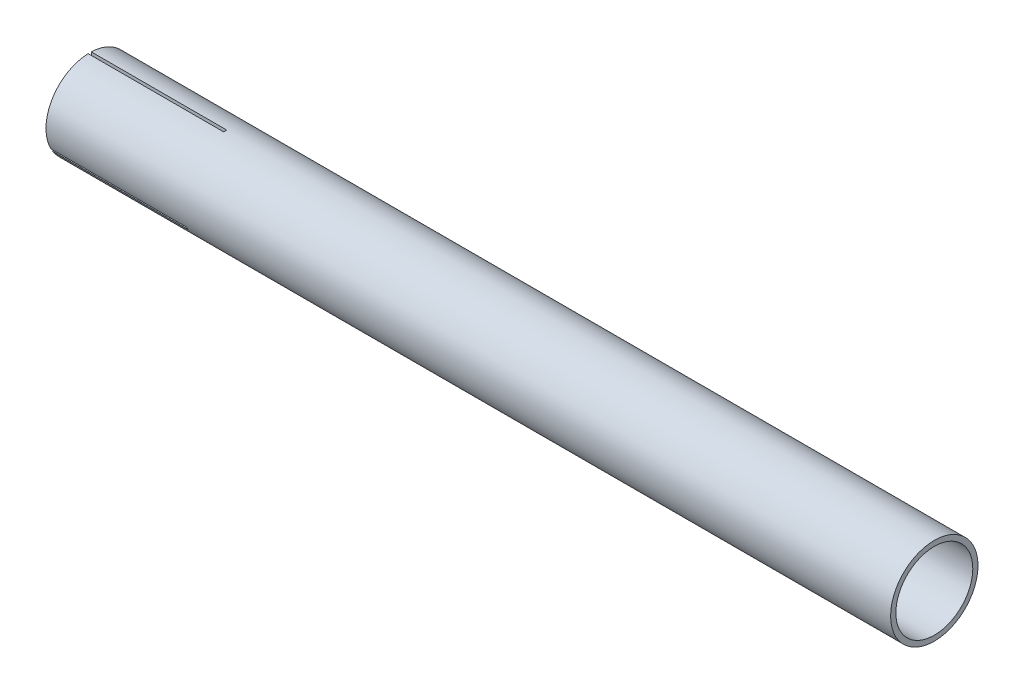
from build123d import *

# Parameters (mm, degrees)
SKETCH1_R               = 41.9
SKETCH1_R_2             = 36.9
BOSS_EXTRUDE1_DEPTH     = 810
CUT_EXTRUDE_THIN1_START = -130
CUT_EXTRUDE_THIN1_DEPTH = 130
SKETCH3_R               = 36.9
BOSS_EXTRUDE2_DEPTH     = 2


# Read off the part's stored shape, not the designer's step: Cut-Extrude-Thin1
with BuildPart() as part:
    # Sketch1 → Boss-Extrude1 (new body)
    with BuildSketch(Plane(origin=(0, 0, 0), x_dir=(0, 0, -1), z_dir=(1, 0, 0))):
        Circle(SKETCH1_R)
        Circle(SKETCH1_R_2, mode=Mode.SUBTRACT)
    extrude(amount=BOSS_EXTRUDE1_DEPTH)

    # Cut-Extrude-Thin1 outline → Cut-Extrude-Thin1 (cut)
    with BuildSketch(Plane.ZY.offset(CUT_EXTRUDE_THIN1_START)):
        with BuildLine():
            ThreePointArc((-31.179923269, -19.733787901), (-31.9563374, -18.45), (-32.67992327, -17.135711689))
            Line((-32.67992327, -17.135711689), (-37.013204492, -19.637532769))
            ThreePointArc((-37.013204492, -19.637532769), (-36.286464419, -20.95), (-35.513204492, -22.235608981))
            Line((-35.513204492, -22.235608981), (-31.179923269, -19.733787901))
        make_face()
        with BuildLine():
            Line((-1.5, 41.87314175), (-1.5, 36.86949959))
            ThreePointArc((-1.5, 36.86949959), (0, 36.9), (1.5, 36.86949959))
            Line((1.5, 36.86949959), (1.5, 41.87314175))
            ThreePointArc((1.5, 41.87314175), (0, 41.9), (-1.5, 41.87314175))
        make_face()
        with BuildLine():
            ThreePointArc((32.67992327, -17.135711689), (31.9563374, -18.45), (31.179923269, -19.733787901))
            Line((31.179923269, -19.733787901), (35.513204492, -22.235608981))
            ThreePointArc((35.513204492, -22.235608981), (36.286464419, -20.95), (37.013204492, -19.637532769))
            Line((37.013204492, -19.637532769), (32.67992327, -17.135711689))
        make_face()
    extrude(amount=CUT_EXTRUDE_THIN1_DEPTH, mode=Mode.SUBTRACT)

    # Sketch3 → Boss-Extrude2 (add)
    with BuildSketch(Plane(origin=(610, 0, 0), x_dir=(0, 0, -1), z_dir=(1, 0, 0))):
        with Locations(Location((0, 0, 0), (0, 0, 207.67026134))):
            Circle(SKETCH3_R)
    extrude(amount=BOSS_EXTRUDE2_DEPTH)


solid = part.part
